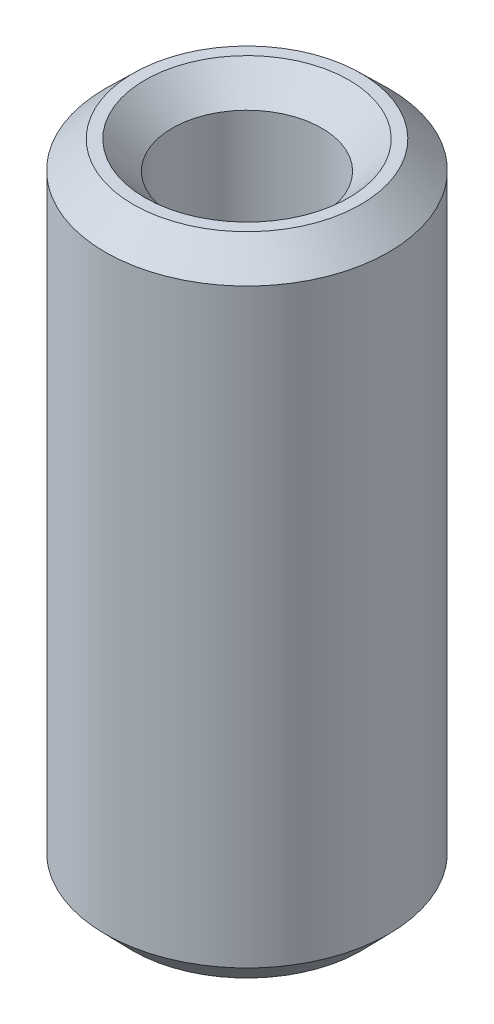
from build123d import *
from OCP.BRepFilletAPI import BRepFilletAPI_MakeChamfer

# Parameters (mm, degrees)
SKETCH1_R           = 12.5
BOSS_EXTRUDE1_DEPTH = 56.957415852
SKETCH2_R           = 6.587498208
CUT_EXTRUDE1_DEPTH  = 60.637632587
CHAMFER1_SIZE       = 2.406473182
CHAMFER1_SIZE2      = 2.468892685


with BuildPart() as part:
    # Sketch1 → Boss-Extrude1 (new body)
    with BuildSketch(Plane(origin=(0, 0, 0), x_dir=(1, 0, 0), z_dir=(0, 1, 0))):
        Circle(SKETCH1_R)
    extrude(amount=BOSS_EXTRUDE1_DEPTH)

    # Sketch2 → Cut-Extrude1 (cut, through all)
    with BuildSketch(Plane(origin=(0, 0, 0), x_dir=(1, 0, 0), z_dir=(0, 1, 0))):
        Circle(SKETCH2_R)
    extrude(amount=CUT_EXTRUDE1_DEPTH, mode=Mode.SUBTRACT)

    # Chamfer1: one chamfer whose edges measure the first distance from different faces: ONE call of the kernel's chamfer builder (chamfer() names one face for all edges)
    chamfer1_edges_1 = [part.edges().sort_by_distance(p)[0] for p in [
        (-6.587498208, 56.957415852, 0),
    ]]
    chamfer1_side_1 = [part.faces().sort_by_distance(p)[0] for p in [
        (-12.146446609, 56.957415852, 0),
    ]]
    chamfer1_edges_2 = [part.edges().sort_by_distance(p)[0] for p in [
        (-6.587498208, 0, 0),
    ]]
    chamfer1_side_2 = [part.faces().sort_by_distance(p)[0] for p in [
        (-6.587498208, 28.478707926, 0),
    ]]
    chamfer1_edges_3 = [part.edges().sort_by_distance(p)[0] for p in [
        (-12.5, 0, 0),
    ]]
    chamfer1_side_3 = [part.faces().sort_by_distance(p)[0] for p in [
        (-12.146446609, 0, 0),
    ]]
    chamfer1_edges_4 = [part.edges().sort_by_distance(p)[0] for p in [
        (-12.5, 56.957415852, 0),
    ]]
    chamfer1_side_4 = [part.faces().sort_by_distance(p)[0] for p in [
        (-12.5, 28.478707926, 0),
    ]]
    chamfer1 = BRepFilletAPI_MakeChamfer(part.part.solid().wrapped)
    for e in chamfer1_edges_1:
        chamfer1.Add(CHAMFER1_SIZE, CHAMFER1_SIZE2, e.wrapped, chamfer1_side_1[0].wrapped)  # the first distance lies on this face
    for e in chamfer1_edges_2:
        chamfer1.Add(CHAMFER1_SIZE, CHAMFER1_SIZE2, e.wrapped, chamfer1_side_2[0].wrapped)  # the first distance lies on this face
    for e in chamfer1_edges_3:
        chamfer1.Add(CHAMFER1_SIZE, CHAMFER1_SIZE2, e.wrapped, chamfer1_side_3[0].wrapped)  # the first distance lies on this face
    for e in chamfer1_edges_4:
        chamfer1.Add(CHAMFER1_SIZE, CHAMFER1_SIZE2, e.wrapped, chamfer1_side_4[0].wrapped)  # the first distance lies on this face
    add(Compound.cast(chamfer1.Shape()), mode=Mode.REPLACE)


solid = part.part
